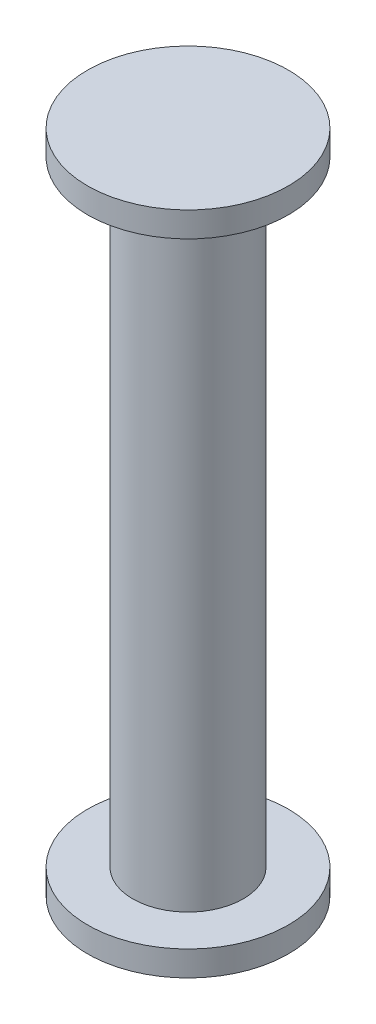
from build123d import *

# Parameters (mm, degrees)
SKETCH1_R           = 2.2
BOSS_EXTRUDE1_DEPTH = 24.5
SKETCH2_R           = 4
BOSS_EXTRUDE2_DEPTH = 1
BOSS_EXTRUDE3_START = 1
SKETCH3_R           = 4
BOSS_EXTRUDE3_DEPTH = 1


with BuildPart() as part:
    # Sketch1 → Boss-Extrude1 (new body)
    with BuildSketch(Plane(origin=(0, 0, 0), x_dir=(1, 0, 0), z_dir=(0, 1, 0))):
        Circle(SKETCH1_R)
    extrude(amount=BOSS_EXTRUDE1_DEPTH)

    # Sketch2 → Boss-Extrude2 (add)
    with BuildSketch(Plane(origin=(0, 24.5, 0), x_dir=(1, 0, 0), z_dir=(0, 1, 0))):
        Circle(SKETCH2_R)
    extrude(amount=BOSS_EXTRUDE2_DEPTH)

    # Sketch3 → Boss-Extrude3 (add)
    with BuildSketch(Plane.XZ.offset(BOSS_EXTRUDE3_START)):
        Circle(SKETCH3_R)
    extrude(amount=-BOSS_EXTRUDE3_DEPTH)


solid = part.part
